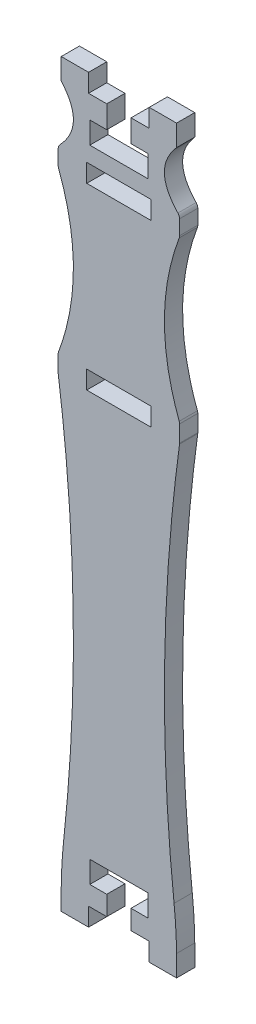
from build123d import *

# Parameters (mm, degrees)
CROQUIS1_W              = 10
CROQUIS1_H              = 3
SALIENTE_EXTRUIR1_DEPTH = 3
CROQUIS2_W              = 0.3
CROQUIS2_H              = 0.3
CROQUIS2_H_2            = 3
CORTAR_EXTRUIR2_DEPTH   = 3
CROQUIS3_W              = 3
CROQUIS3_H              = 3.5
CORTAR_EXTRUIR3_DEPTH   = 0.5
CROQUIS4_W              = 3
CROQUIS4_H              = 3.5
CORTAR_EXTRUIR4_DEPTH   = 0.5
CROQUIS5_W              = 3
CROQUIS5_H              = 3.5
CORTAR_EXTRUIR5_DEPTH   = 0.5
CROQUIS6_W              = 3
CROQUIS6_H              = 3.5
CORTAR_EXTRUIR6_DEPTH   = 0.5
REDONDEO1_START         = -1
REDONDEO1_DEPTH         = 5


with BuildPart() as part:
    # Croquis1 → Saliente-Extruir1 (new body)
    with BuildSketch(Plane.XY):
        with BuildLine():
            Line((-10, 70), (-10, 67))
            Line((-10, 67), (-7, 67))
            Line((-7, 67), (-7, 63))
            Line((-7, 63), (-9.5, 63))
            Line((-9.5, 63), (-9.5, 60))
            Line((-9.5, 60), (-0.5, 60))
            Line((-0.5, 60), (-0.5, 63))
            Line((-0.5, 63), (-3, 63))
            Line((-3, 63), (-3, 67))
            Line((-3, 67), (0, 67))
            Line((0, 67), (0, 70))
            Line((0, 70), (5, 70))
            Line((5, 70), (5, 67.405747627))
            ThreePointArc((5, 67.405747627), (4.929306729, 67.036438809), (4.727221995, 66.719345288))
            add(Edge.make_bspline(
                [(4.727221995, 66.719345288), (3.242407332, 65.146230192), (1.757592668, 62), (3.242407332, 58.853769808), (4.727221995, 57.280654712)],
                knots=[0.028065471, 0.028065471, 0.028065471, 0.028065471, 0.5, 0.971934529, 0.971934529, 0.971934529, 0.971934529], degree=3))
            ThreePointArc((4.727221995, 57.280654712), (4.929306729, 56.963561191), (5, 56.594252373))
            Line((5, 56.594252373), (5, 54.181314171))
            ThreePointArc((5, 54.181314171), (4.9841425, 54.003934523), (4.937072921, 53.832180471))
            add(Edge.make_bspline(
                [(4.937072921, 53.832180471), (3.31235764, 49.471453647), (1.68764236, 40.75), (3.31235764, 32.028546353), (4.937072921, 27.667819529)],
                knots=[0.006332812, 0.006332812, 0.006332812, 0.006332812, 0.5, 0.993667188, 0.993667188, 0.993667188, 0.993667188], degree=3))
            ThreePointArc((4.937072921, 27.667819529), (4.9841425, 27.496065477), (5, 27.318685829))
            Line((5, 27.318685829), (5, 24.567654138))
            ThreePointArc((5, 24.567654138), (4.997723384, 24.500214919), (4.990903903, 24.433082766))
            add(Edge.make_bspline(
                [(4.990903903, -48.933082766), (3.330301301, -36.70538851), (1.669698699, -12.25), (3.330301301, 12.20538851), (4.990903903, 24.433082766)],
                knots=[0.000910439, 0.000910439, 0.000910439, 0.000910439, 0.5, 0.999089561, 0.999089561, 0.999089561, 0.999089561], degree=3))
            ThreePointArc((4.990903903, -48.933082766), (4.997723384, -49.000214919), (5, -49.067654138))
            Line((5, -49.067654138), (5, -51.701381229))
            Line((5, -51.701381229), (5, -52))
            Line((5, -52), (0, -52))
            Line((0, -52), (0, -49))
            Line((0, -49), (-3, -49))
            Line((-3, -49), (-3, -45.5))
            Line((-3, -45.5), (-0.5, -45.5))
            Line((-0.5, -45.5), (-0.5, -42.5))
            Line((-0.5, -42.5), (-9.5, -42.5))
            Line((-9.5, -42.5), (-9.5, -45.5))
            Line((-9.5, -45.5), (-7, -45.5))
            Line((-7, -45.5), (-7, -49))
            Line((-7, -49), (-10, -49))
            Line((-10, -49), (-10, -52))
            Line((-10, -52), (-15, -52))
            Line((-15, -52), (-15, -51.701381229))
            Line((-15, -51.701381229), (-15, -49.067654138))
            ThreePointArc((-15, -49.067654138), (-14.997723384, -49.000214919), (-14.990903903, -48.933082766))
            add(Edge.make_bspline(
                [(-14.990903903, -48.933082766), (-13.330301301, -36.70538851), (-11.669698699, -12.25), (-13.330301301, 12.20538851), (-14.990903903, 24.433082766)],
                knots=[0.000910439, 0.000910439, 0.000910439, 0.000910439, 0.5, 0.999089561, 0.999089561, 0.999089561, 0.999089561], degree=3))
            ThreePointArc((-14.990903903, 24.433082766), (-14.997723384, 24.500214919), (-15, 24.567654138))
            Line((-15, 24.567654138), (-15, 27.318685829))
            ThreePointArc((-15, 27.318685829), (-14.9841425, 27.496065477), (-14.937072921, 27.667819529))
            add(Edge.make_bspline(
                [(-14.937072921, 53.832180471), (-13.31235764, 49.471453647), (-11.68764236, 40.75), (-13.31235764, 32.028546353), (-14.937072921, 27.667819529)],
                knots=[0.006332812, 0.006332812, 0.006332812, 0.006332812, 0.5, 0.993667188, 0.993667188, 0.993667188, 0.993667188], degree=3))
            ThreePointArc((-14.937072921, 53.832180471), (-14.9841425, 54.003934523), (-15, 54.181314171))
            Line((-15, 54.181314171), (-15, 56.594252373))
            ThreePointArc((-15, 56.594252373), (-14.929306729, 56.963561191), (-14.727221995, 57.280654712))
            add(Edge.make_bspline(
                [(-14.727221995, 57.280654712), (-13.242407332, 58.853769808), (-11.757592668, 62), (-13.242407332, 65.146230192), (-14.727221995, 66.719345288)],
                knots=[0.028065471, 0.028065471, 0.028065471, 0.028065471, 0.5, 0.971934529, 0.971934529, 0.971934529, 0.971934529], degree=3))
            ThreePointArc((-14.727221995, 66.719345288), (-14.929306729, 67.036438809), (-15, 67.405747627))
            Line((-15, 67.405747627), (-15, 70))
            Line((-15, 70), (-10, 70))
        make_face()
        with Locations((-5, 26)):
            Rectangle(CROQUIS1_W, CROQUIS1_H, mode=Mode.SUBTRACT)
        with Locations((-5, 55.5)):
            Rectangle(CROQUIS1_W, CROQUIS1_H, mode=Mode.SUBTRACT)
    extrude(amount=SALIENTE_EXTRUIR1_DEPTH)

    # Croquis2 → Cortar-Extruir2 (cut)
    with BuildSketch(Plane.XY.offset(3)):
        Polygon((-9.8, -45.5), (-9.8, -45.8), (-9.5, -45.8), (-7, -45.8), (-7, -45.5), (-9.5, -45.5), (-9.5, -42.5), (-0.5, -42.5), (-0.5, -42.2), (-9.5, -42.2), (-9.8, -42.2), (-9.8, -42.5), align=None)
        Polygon((-0.5, -45.8), (-0.2, -45.8), (-0.2, -45.5), (-0.2, -42.5), (-0.5, -42.5), (-0.5, -45.5), (-3, -45.5), (-3, -45.8), align=None)
        with Locations((-0.35, -42.35)):
            Rectangle(CROQUIS2_W, CROQUIS2_H)
        with Locations((-10.15, 26)):
            Rectangle(CROQUIS2_W, CROQUIS2_H_2)
        with Locations((0.15, 26)):
            Rectangle(CROQUIS2_W, CROQUIS2_H_2)
        with Locations((0.15, 55.5)):
            Rectangle(CROQUIS2_W, CROQUIS2_H_2)
        with Locations((-10.15, 55.5)):
            Rectangle(CROQUIS2_W, CROQUIS2_H_2)
        Polygon((-9.8, 63.3), (-9.5, 63.3), (-7, 63.3), (-7, 63), (-9.5, 63), (-9.5, 60), (-0.5, 60), (-0.5, 63), (-3, 63), (-3, 63.3), (-0.5, 63.3), (-0.2, 63.3), (-0.2, 63), (-0.2, 60), (-0.2, 59.7), (-0.5, 59.7), (-9.5, 59.7), (-9.8, 59.7), (-9.8, 60), (-9.8, 63), align=None)
    extrude(amount=-CORTAR_EXTRUIR2_DEPTH, mode=Mode.SUBTRACT)

    # Croquis3 → Cortar-Extruir3 (cut)
    with BuildSketch(Plane.ZY.offset(15)):
        with Locations((1.5, -50.25)):
            Rectangle(CROQUIS3_W, CROQUIS3_H)
    extrude(amount=-CORTAR_EXTRUIR3_DEPTH, mode=Mode.SUBTRACT)

    # Croquis4 → Cortar-Extruir4 (cut)
    with BuildSketch(Plane(origin=(5, 0, 0), x_dir=(0, 0, -1), z_dir=(1, 0, 0))):
        with Locations((-1.5, -50.25)):
            Rectangle(CROQUIS4_W, CROQUIS4_H)
    extrude(amount=-CORTAR_EXTRUIR4_DEPTH, mode=Mode.SUBTRACT)

    # Croquis5 → Cortar-Extruir5 (cut)
    with BuildSketch(Plane.ZY.offset(15)):
        with Locations((1.5, 68.25)):
            Rectangle(CROQUIS5_W, CROQUIS5_H)
    extrude(amount=-CORTAR_EXTRUIR5_DEPTH, mode=Mode.SUBTRACT)

    # Croquis6 → Cortar-Extruir6 (cut)
    with BuildSketch(Plane(origin=(5, 0, 0), x_dir=(0, 0, -1), z_dir=(1, 0, 0))):
        with Locations((-1.5, 68.25)):
            Rectangle(CROQUIS6_W, CROQUIS6_H)
    extrude(amount=-CORTAR_EXTRUIR6_DEPTH, mode=Mode.SUBTRACT)

    # Redondeo1: read off the stored shape, not the designer's step
    # Redondeo1 outline → Redondeo1 (cut)
    with BuildSketch(Plane.XY.offset(REDONDEO1_START)):
        with BuildLine():
            Line((-14.932435559, -48.5), (-14.5, -48.5))
            ThreePointArc((-14.5, -48.5), (-14.379883961, -45.021273255), (-14.08941772, -41.552614006))
            add(Edge.make_bspline(
                [(-14.932435559, -48.5), (-14.621648088, -46.184204669), (-14.340642142, -43.868409337), (-14.08941772, -41.552614006)],
                knots=[0.006802721, 0.006802721, 0.006802721, 0.006802721, 0.10132498, 0.10132498, 0.10132498, 0.10132498], degree=3))
        make_face()
        with BuildLine():
            add(Edge.make_bspline(
                [(4.932435559, -48.5), (4.621648088, -46.184204669), (4.340642142, -43.868409337), (4.08941772, -41.552614006)],
                knots=[0.006802721, 0.006802721, 0.006802721, 0.006802721, 0.10132498, 0.10132498, 0.10132498, 0.10132498], degree=3))
            ThreePointArc((4.08941772, -41.552614006), (4.379883961, -45.021273255), (4.5, -48.5))
            Line((4.5, -48.5), (4.932435559, -48.5))
        make_face()
        with BuildLine():
            Line((4.525, 66.5), (4.5, 66.5))
            ThreePointArc((4.5, 66.5), (4.313911858, 66.266314057), (4.126842149, 66.033413132))
            add(Edge.make_bspline(
                [(4.525, 66.5), (4.38502394, 66.344471044), (4.252304656, 66.188942088), (4.126842149, 66.033413132)],
                knots=[0.05, 0.05, 0.05, 0.05, 0.096658687, 0.096658687, 0.096658687, 0.096658687], degree=3))
        make_face()
        with BuildLine():
            add(Edge.make_bspline(
                [(-14.126842149, 66.033413132), (-14.252304656, 66.188942088), (-14.38502394, 66.344471044), (-14.525, 66.5)],
                knots=[0.903341313, 0.903341313, 0.903341313, 0.903341313, 0.95, 0.95, 0.95, 0.95], degree=3))
            ThreePointArc((-14.126842149, 66.033413132), (-14.313911858, 66.266314057), (-14.5, 66.5))
            Line((-14.5, 66.5), (-14.525, 66.5))
        make_face()
    extrude(amount=REDONDEO1_DEPTH, mode=Mode.SUBTRACT)


solid = part.part
